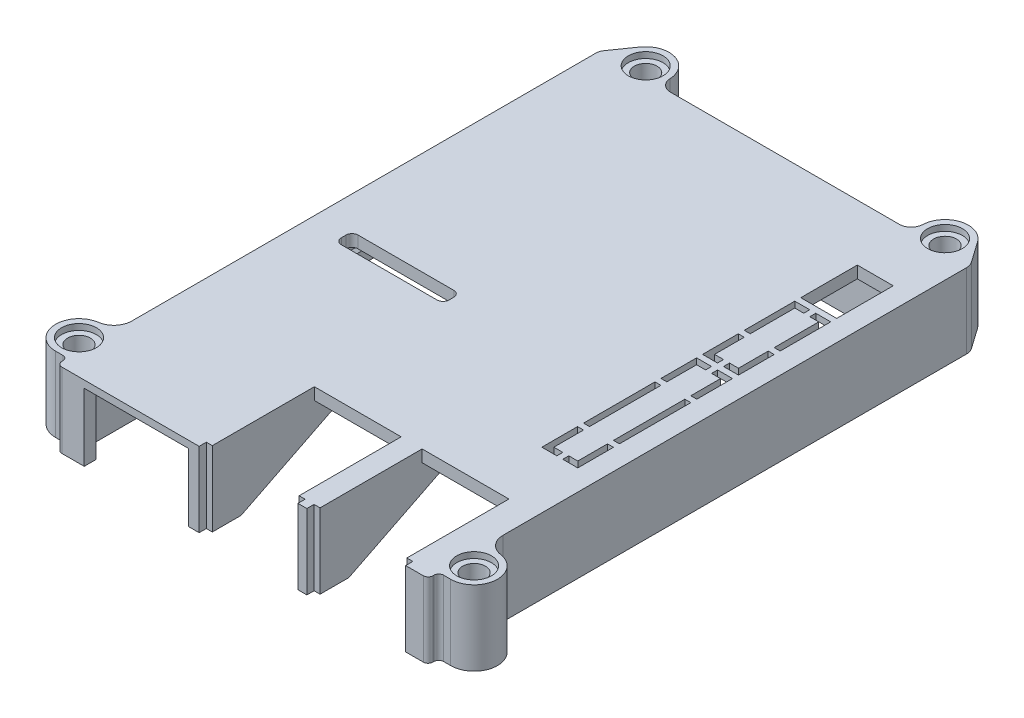
from build123d import *

# Parameters (mm, degrees)
CUT_EXTRUDE1_START                                 = -10.5
CUT_EXTRUDE1_DEPTH                                 = 12.5
CUT_EXTRUDE1_START_2                               = -4.07
CUT_EXTRUDE1_2_DEPTH                               = 6.07
CUT_EXTRUDE1_3_DEPTH                               = 2.5
CUT_EXTRUDE1_START_3                               = -74.55
CUT_EXTRUDE1_4_DEPTH                               = 26.9
CUT_EXTRUDE1_START_4                               = -87.55
CUT_EXTRUDE1_5_DEPTH                               = 15.9
SKETCH2_W                                          = 19.95
SKETCH2_H                                          = 39.9
CUT_EXTRUDE2_DEPTH                                 = 4.07
SKETCH3_W                                          = 39.9
SKETCH3_H                                          = 10.5
CUT_EXTRUDE3_DEPTH                                 = 2.8
SKETCH4_W                                          = 22.75
SKETCH4_H                                          = 10.5
CUT_EXTRUDE4_DEPTH                                 = 5.45
SKETCH5_W                                          = 45.35
SKETCH5_H                                          = 10.5
CUT_EXTRUDE5_DEPTH                                 = 14.5
CUT_EXTRUDE6_DEPTH                                 = 14.5
CUT_EXTRUDE7_DEPTH                                 = 3.5
CUT_EXTRUDE8_DEPTH                                 = 2.8
CUT_EXTRUDE9_DEPTH                                 = 17.4
CUT_EXTRUDE10_DEPTH                                = 14.5
SKETCH11_W                                         = 2.55
SKETCH11_H                                         = 10.5
CUT_EXTRUDE11_DEPTH                                = 41.25
CUT_EXTRUDE12_DEPTH                                = 2.75
BOSS_EXTRUDE1_DEPTH                                = 1.78
CUT_EXTRUDE13_DEPTH                                = 1.5
CUT_EXTRUDE14_DEPTH                                = 1
CUT_EXTRUDE15_DEPTH                                = 2.75
SKETCH17_W                                         = 52.7
SKETCH17_H                                         = 1
CUT_EXTRUDE16_DEPTH                                = 1
CUT_EXTRUDE17_DEPTH                                = 1.5
SKETCH19_W                                         = 1
SKETCH19_H                                         = 1
CUT_EXTRUDE18_DEPTH                                = 4.9625
SKETCH20_W                                         = 1.5
SKETCH20_H                                         = 1
CUT_EXTRUDE19_DEPTH                                = 1
SKETCH21_W                                         = 1
SKETCH21_H                                         = 1
CUT_EXTRUDE20_DEPTH                                = 11.925
SKETCH22_W                                         = 2.5
SKETCH22_H                                         = 1
CUT_EXTRUDE21_DEPTH                                = 1
SKETCH23_W                                         = 1
SKETCH23_H                                         = 1
CUT_EXTRUDE22_DEPTH                                = 11.925
SKETCH24_W                                         = 1.5
SKETCH24_H                                         = 1
CUT_EXTRUDE23_DEPTH                                = 1
SKETCH25_W                                         = 1.5
SKETCH25_H                                         = 1
CUT_EXTRUDE24_DEPTH                                = 1
SKETCH26_W                                         = 1.5
SKETCH26_H                                         = 1
CUT_EXTRUDE25_DEPTH                                = 1
SKETCH27_W                                         = 4.9625
SKETCH27_H                                         = 1
CUT_EXTRUDE26_DEPTH                                = 1
SKETCH28_W                                         = 1.5
SKETCH28_H                                         = 1
CUT_EXTRUDE27_DEPTH                                = 1
CUT_EXTRUDE28_DEPTH                                = 1
CUT_EXTRUDE29_DEPTH                                = 14.5
CUT_EXTRUDE30_DEPTH                                = 14.5
SKETCH32_W                                         = 1
SKETCH32_H                                         = 1
CUT_EXTRUDE31_DEPTH                                = 11.925
SKETCH33_W                                         = 33.4
SKETCH33_H                                         = 2
BOSS_EXTRUDE2_DEPTH                                = 3
CUT_EXTRUDE32_REACH                                = 124.251
SKETCH35_W                                         = 17.4
SKETCH35_H                                         = 22.7
SKETCH36_W                                         = 1.5
SKETCH36_H                                         = 21
CUT_EXTRUDE33_DEPTH                                = 5.93
CUT_EXTRUDE34_REACH                                = 123.333
SKETCH37_W                                         = 16.5
SKETCH37_H                                         = 3.93
SKETCH38_W                                         = 1
SKETCH38_H                                         = 1.2
CUT_EXTRUDE35_DEPTH                                = 123.053605027
SKETCH39_W                                         = 1
SKETCH39_H                                         = 1.2
CUT_EXTRUDE36_DEPTH                                = 123.397232403
SKETCH40_W                                         = 1
SKETCH40_H                                         = 1.2
CUT_EXTRUDE37_DEPTH                                = 123.397232403
SKETCH41_W                                         = 1
SKETCH41_H                                         = 1.2
CUT_EXTRUDE38_DEPTH                                = 123.397232403
CUT_EXTRUDE39_DEPTH                                = 123.160069172
SKETCH43_W                                         = 18
SKETCH43_H                                         = 2.8
CUT_EXTRUDE40_DEPTH                                = 123.160069172
SKETCH44_W                                         = 18
SKETCH44_H                                         = 2.8
CUT_EXTRUDE41_DEPTH                                = 123.160069172
CUT_EXTRUDE42_DEPTH                                = 123.160069172
CUT_EXTRUDE43_DEPTH                                = 123.160069172
CUT_EXTRUDE44_DEPTH                                = 123.160069172
CUT_EXTRUDE45_DEPTH                                = 123.160069172
CUT_EXTRUDE46_DEPTH                                = 123.397232403
SKETCH50_W                                         = 16.5
SKETCH50_H                                         = 1
CUT_EXTRUDE47_DEPTH                                = 1.5
SKETCH51_W                                         = 1.5
SKETCH51_H                                         = 12
CUT_EXTRUDE48_DEPTH                                = 2
F_8_0_8_DIAMETER_HOLE1_D                           = 8
CBORE_FOR_M3_5_HEX_HEAD_MACHINE_SCREW1_D           = 3.8
CBORE_FOR_M3_5_HEX_HEAD_MACHINE_SCREW1_CBORE_D     = 5.8
CBORE_FOR_M3_5_HEX_HEAD_MACHINE_SCREW1_CBORE_DEPTH = 1
CBORE_FOR_M6_HEX_HEAD_BOLT1_D                      = 7
CBORE_FOR_M6_HEX_HEAD_BOLT1_DEPTH                  = 2
CBORE_FOR_M6_HEX_HEAD_BOLT1_CBORE_D                = 9.5
CBORE_FOR_M6_HEX_HEAD_BOLT1_CBORE_DEPTH            = 1
CHAMFER1_SIZE                                      = 0.5
FILLET1_R                                          = 0.8
FILLET2_R                                          = 1
FILLET3_R                                          = 2
FILLET4_R                                          = 3
SKETCH59_W                                         = 23.655840722
SKETCH59_H                                         = 10.256378495
SKETCH59_H_2                                       = 9.778608779
BOSS_EXTRUDE3_DEPTH                                = 2
SKETCH60_W                                         = 25.28962762
SKETCH60_H                                         = 9.476601037
BOSS_EXTRUDE4_DEPTH                                = 2
SKETCH62_W                                         = 6
SKETCH62_H                                         = 18.8875
CUT_EXTRUDE49_DEPTH                                = 2
SKETCH64_W                                         = 6
SKETCH64_H                                         = 9.44375
BOSS_EXTRUDE5_DEPTH                                = 1
CUT_EXTRUDE50_DEPTH                                = 1


with BuildPart() as part:
    # Cut-Extrude1: read off the stored shape, not the designer's step
    # Cut-Extrude1 outline → Cut-Extrude1 (new body)
    with BuildSketch(Plane(origin=(0, 0, 0), x_dir=(1, 0, 0), z_dir=(0, 1, 0)).offset(CUT_EXTRUDE1_START)):
        with BuildLine():
            Line((52.514673616, 95), (9.485326384, 95))
            ThreePointArc((9.485326384, 95), (8.002589698, 100.096585499), (2.81042862, 98.994244731))
            Line((2.81042862, 98.994244731), (0, 95))
            Line((0, 95), (0, 13.428133809))
            ThreePointArc((0, 13.428133809), (-5.75950275, 11.117371232), (-2, 6.18))
            Line((-2, 6.18), (64, 6.18))
            ThreePointArc((64, 6.18), (67.75950275, 11.117371232), (62, 13.428133809))
            Line((62, 13.428133809), (62, 95))
            Line((62, 95), (59.18957138, 98.994244731))
            ThreePointArc((59.18957138, 98.994244731), (53.997410302, 100.096585499), (52.514673616, 95))
        make_face()
        Polygon((2.5, 71.15), (2, 71.65), (2, 87.55), (21.95, 87.55), (21.95, 47.65), (2, 47.65), (2.5, 48.15), align=None, mode=Mode.SUBTRACT)
    extrude(amount=CUT_EXTRUDE1_DEPTH)

    # Cut-Extrude1 2 outline → Cut-Extrude1 2 (add)
    with BuildSketch(Plane(origin=(0, 0, 0), x_dir=(1, 0, 0), z_dir=(0, 1, 0)).offset(CUT_EXTRUDE1_START_2)):
        Polygon((2, 71.65), (2.5, 71.15), (2.5, 48.15), (2, 47.65), (21.95, 47.65), (21.95, 87.55), (2, 87.55), align=None)
    extrude(amount=CUT_EXTRUDE1_2_DEPTH)

    # Cut-Extrude1 3 outline → Cut-Extrude1 3 (add)
    with BuildSketch(Plane(origin=(0, 0, 0), x_dir=(1, 0, 0), z_dir=(0, 1, 0)).offset(CUT_EXTRUDE1_START)):
        Polygon((2, 87.55), (2, 74.55), (2.5, 75.05), (2.5, 87.05), align=None)
    extrude(amount=CUT_EXTRUDE1_3_DEPTH)

    # Cut-Extrude1 4 outline → Cut-Extrude1 4 (cut)
    with BuildSketch(Plane.XY.offset(CUT_EXTRUDE1_START_3)):
        Polygon((2, -4.07), (2.5, -4.57), (2.5, -4.07), align=None)
    extrude(amount=CUT_EXTRUDE1_4_DEPTH, mode=Mode.SUBTRACT)

    # Cut-Extrude1 5 outline → Cut-Extrude1 5 (cut)
    with BuildSketch(Plane.XY.offset(CUT_EXTRUDE1_START_4)):
        Polygon((2.5, -8.5), (2.5, -8), (2, -8), align=None)
    extrude(amount=CUT_EXTRUDE1_5_DEPTH, mode=Mode.SUBTRACT)

    # Sketch2 → Cut-Extrude2 (cut)
    with BuildSketch(Plane.XZ.offset(4.07)):
        with Locations((11.975, -67.6)):
            Rectangle(SKETCH2_W, SKETCH2_H)
    extrude(amount=-CUT_EXTRUDE2_DEPTH, mode=Mode.SUBTRACT)

    # Sketch3 → Cut-Extrude3 (cut)
    with BuildSketch(Plane.ZY.offset(-21.95)):
        with Locations((-67.6, -5.25)):
            Rectangle(SKETCH3_W, SKETCH3_H)
    extrude(amount=-CUT_EXTRUDE3_DEPTH, mode=Mode.SUBTRACT)

    # Sketch4 → Cut-Extrude4 (cut)
    with BuildSketch(Plane.XY.offset(-87.55)):
        with Locations((13.375, -5.25)):
            Rectangle(SKETCH4_W, SKETCH4_H)
    extrude(amount=-CUT_EXTRUDE4_DEPTH, mode=Mode.SUBTRACT)

    # Sketch5 → Cut-Extrude5 (cut)
    with BuildSketch(Plane.ZY.offset(-24.75)):
        with Locations((-70.325, -5.25)):
            Rectangle(SKETCH5_W, SKETCH5_H)
    extrude(amount=-CUT_EXTRUDE5_DEPTH, mode=Mode.SUBTRACT)

    # Sketch6 → Cut-Extrude6 (cut)
    with BuildSketch(Plane(origin=(39.25, 0, 0), x_dir=(0, 0, -1), z_dir=(1, 0, 0))):
        Polygon((31.4, 0), (10.4, -10.5), (47.65, -10.5), (47.65, 0), align=None)
    extrude(amount=-CUT_EXTRUDE6_DEPTH, mode=Mode.SUBTRACT)

    # Sketch7 → Cut-Extrude7 (cut)
    with BuildSketch(Plane.ZY.offset(-39.25)):
        Polygon((-10.4, -10.5), (-31.4, 0), (-93, 0), (-93, -10.5), align=None)
    extrude(amount=-CUT_EXTRUDE7_DEPTH, mode=Mode.SUBTRACT)

    # Sketch8 → Cut-Extrude8 (cut)
    with BuildSketch(Plane(origin=(24.75, 0, 0), x_dir=(0, 0, -1), z_dir=(1, 0, 0))):
        Polygon((31.4, 0), (10.4, -10.5), (47.65, -10.5), (47.65, 0), align=None)
    extrude(amount=-CUT_EXTRUDE8_DEPTH, mode=Mode.SUBTRACT)

    # Sketch9 → Cut-Extrude9 (cut)
    with BuildSketch(Plane(origin=(21.95, 0, 0), x_dir=(0, 0, -1), z_dir=(1, 0, 0))):
        Polygon((47.65, 0), (6.18, 0), (6.18, -10.5), (6.4, -10.5), (47.65, -10.5), align=None)
    extrude(amount=-CUT_EXTRUDE9_DEPTH, mode=Mode.SUBTRACT)

    # Sketch10 → Cut-Extrude10 (cut)
    with BuildSketch(Plane.ZY.offset(-42.75)):
        Polygon((-10.4, -10.5), (-31.4, 0), (-93, 0), (-93, -10.5), align=None)
    extrude(amount=-CUT_EXTRUDE10_DEPTH, mode=Mode.SUBTRACT)

    # Sketch11 → Cut-Extrude11 (cut)
    with BuildSketch(Plane(origin=(0, 0, -47.65), x_dir=(-1, 0, 0), z_dir=(0, 0, -1))):
        with Locations((-3.275, -5.25)):
            Rectangle(SKETCH11_W, SKETCH11_H)
    extrude(amount=-CUT_EXTRUDE11_DEPTH, mode=Mode.SUBTRACT)

    # Sketch12 → Cut-Extrude12 (cut)
    with BuildSketch(Plane.ZY.offset(-57.25)):
        Polygon((-10.4, -10.5), (-31.4, 0), (-93, 0), (-93, -10.5), align=None)
    extrude(amount=-CUT_EXTRUDE12_DEPTH, mode=Mode.SUBTRACT)

    # Sketch13 → Boss-Extrude1 (add)
    with BuildSketch(Plane.XY.offset(-6.18)):
        Polygon((62, 2), (62, -10.5), (21.95, -10.5), (21.95, 0), (4.55, 0), (4.55, -10.5), (0, -10.5), (0, 2), align=None)
    extrude(amount=BOSS_EXTRUDE1_DEPTH)

    # Sketch14 → Cut-Extrude13 (cut)
    with BuildSketch(Plane(origin=(56, 0, 0), x_dir=(0, -1, 0), z_dir=(-1, 0, 0))):
        Polygon((-1, -33.9), (-1, -85.6), (0, -85.6), (0, -32.9), (-2, -32.9), (-2, -33.9), align=None)
    extrude(amount=-CUT_EXTRUDE13_DEPTH, mode=Mode.SUBTRACT)

    # Sketch15 → Cut-Extrude14 (cut)
    with BuildSketch(Plane.ZY.offset(-57.5)):
        Polygon((-58.75, 2), (-58.75, 1), (-79.6375, 1), (-79.6375, 2), (-85.6, 2), (-85.6, 0), (-32.9, 0), (-32.9, 2), (-33.9, 2), (-33.9, 1), (-52.7875, 1), (-52.7875, 2), align=None)
    extrude(amount=-CUT_EXTRUDE14_DEPTH, mode=Mode.SUBTRACT)

    # Sketch16 → Cut-Extrude15 (cut)
    with BuildSketch(Plane(origin=(60, 0, 0), x_dir=(0, 0, -1), z_dir=(1, 0, 0))):
        Polygon((6.4, 0), (6.4, -10.5), (10.4, -10.5), (31.4, 0), align=None)
    extrude(amount=-CUT_EXTRUDE15_DEPTH, mode=Mode.SUBTRACT)

    # Sketch17 → Cut-Extrude16 (cut)
    with BuildSketch(Plane(origin=(56, 0, 0), x_dir=(0, 0, -1), z_dir=(1, 0, 0))):
        with Locations((59.25, 0.5)):
            Rectangle(SKETCH17_W, SKETCH17_H)
    extrude(amount=-CUT_EXTRUDE16_DEPTH, mode=Mode.SUBTRACT)

    # Sketch18 → Cut-Extrude17 (cut)
    with BuildSketch(Plane(origin=(55, 0, 0), x_dir=(0, 0, -1), z_dir=(1, 0, 0))):
        Polygon((84.6, 2), (84.6, 1), (32.9, 1), (32.9, 0), (85.6, 0), (85.6, 2), align=None)
    extrude(amount=-CUT_EXTRUDE17_DEPTH, mode=Mode.SUBTRACT)

    # Sketch19 → Cut-Extrude18 (cut)
    with BuildSketch(Plane(origin=(0, 0, -65.7125), x_dir=(-1, 0, 0), z_dir=(0, 0, -1))):
        with Locations((-58, 1.5)):
            Rectangle(SKETCH19_W, SKETCH19_H)
    extrude(amount=-CUT_EXTRUDE18_DEPTH, mode=Mode.SUBTRACT)

    # Sketch20 → Cut-Extrude19 (cut)
    with BuildSketch(Plane.XY.offset(-57.75)):
        with Locations((54.25, 1.5)):
            Rectangle(SKETCH20_W, SKETCH20_H)
    extrude(amount=-CUT_EXTRUDE19_DEPTH, mode=Mode.SUBTRACT)

    # Sketch21 → Cut-Extrude20 (cut)
    with BuildSketch(Plane(origin=(0, 0, -51.7875), x_dir=(-1, 0, 0), z_dir=(0, 0, -1))):
        with Locations((-58, 1.5)):
            Rectangle(SKETCH21_W, SKETCH21_H)
    extrude(amount=-CUT_EXTRUDE20_DEPTH, mode=Mode.SUBTRACT)

    # Sketch22 → Cut-Extrude21 (cut)
    with BuildSketch(Plane(origin=(0, 0, -60.75), x_dir=(-1, 0, 0), z_dir=(0, 0, -1))):
        with Locations((-57.25, 1.5)):
            Rectangle(SKETCH22_W, SKETCH22_H)
    extrude(amount=-CUT_EXTRUDE21_DEPTH, mode=Mode.SUBTRACT)

    # Sketch23 → Cut-Extrude22 (cut)
    with BuildSketch(Plane(origin=(0, 0, -78.6375), x_dir=(-1, 0, 0), z_dir=(0, 0, -1))):
        with Locations((-58, 1.5)):
            Rectangle(SKETCH23_W, SKETCH23_H)
    extrude(amount=-CUT_EXTRUDE22_DEPTH, mode=Mode.SUBTRACT)

    # Sketch24 → Cut-Extrude23 (cut)
    with BuildSketch(Plane(origin=(0, 0, -58.75), x_dir=(-1, 0, 0), z_dir=(0, 0, -1))):
        with Locations((-56.75, 1.5)):
            Rectangle(SKETCH24_W, SKETCH24_H)
    extrude(amount=-CUT_EXTRUDE23_DEPTH, mode=Mode.SUBTRACT)

    # Sketch25 → Cut-Extrude24 (cut)
    with BuildSketch(Plane.XY.offset(-59.75)):
        with Locations((54.25, 1.5)):
            Rectangle(SKETCH25_W, SKETCH25_H)
    extrude(amount=-CUT_EXTRUDE24_DEPTH, mode=Mode.SUBTRACT)

    # Sketch26 → Cut-Extrude25 (cut)
    with BuildSketch(Plane(origin=(0, 0, -85.6), x_dir=(-1, 0, 0), z_dir=(0, 0, -1))):
        with Locations((-56.75, 1.5)):
            Rectangle(SKETCH26_W, SKETCH26_H)
    extrude(amount=-CUT_EXTRUDE25_DEPTH, mode=Mode.SUBTRACT)

    # Sketch27 → Cut-Extrude26 (cut)
    with BuildSketch(Plane(origin=(58.5, 0, 0), x_dir=(0, 0, -1), z_dir=(1, 0, 0))):
        with Locations((36.38125, 1.5)):
            Rectangle(SKETCH27_W, SKETCH27_H)
    extrude(amount=-CUT_EXTRUDE26_DEPTH, mode=Mode.SUBTRACT)

    # Sketch28 → Cut-Extrude27 (cut)
    with BuildSketch(Plane.XY.offset(-32.9)):
        with Locations((54.25, 1.5)):
            Rectangle(SKETCH28_W, SKETCH28_H)
    extrude(amount=-CUT_EXTRUDE27_DEPTH, mode=Mode.SUBTRACT)

    # Sketch29 → Cut-Extrude28 (cut)
    with BuildSketch(Plane(origin=(53.5, 0, 0), x_dir=(0, 0, -1), z_dir=(1, 0, 0))):
        Polygon((79.6375, 1), (65.7125, 1), (65.7125, 2), (59.75, 2), (59.75, 1), (58.75, 1), (58.75, 2), (52.7875, 2), (52.7875, 1), (51.7875, 1), (51.7875, 2), (39.8625, 2), (39.8625, 1), (38.8625, 1), (38.8625, 2), (32.9, 2), (32.9, 0), (85.6, 0), (85.6, 2), (79.6375, 2), align=None)
    extrude(amount=-CUT_EXTRUDE28_DEPTH, mode=Mode.SUBTRACT)

    # Sketch30 → Cut-Extrude29 (cut)
    with BuildSketch(Plane(origin=(57.25, 0, 0), x_dir=(0, 0, -1), z_dir=(1, 0, 0))):
        Polygon((22.65, 0), (22.65, 2), (4.4, 2), (4.4, -10.5), (10.4, -10.5), (31.4, 0), align=None)
    extrude(amount=-CUT_EXTRUDE29_DEPTH, mode=Mode.SUBTRACT)

    # Sketch31 → Cut-Extrude30 (cut)
    with BuildSketch(Plane(origin=(39.25, 0, 0), x_dir=(0, 0, -1), z_dir=(1, 0, 0))):
        Polygon((22.65, 0), (22.65, 2), (4.4, 2), (4.4, -10.5), (10.4, -10.5), (31.4, 0), align=None)
    extrude(amount=-CUT_EXTRUDE30_DEPTH, mode=Mode.SUBTRACT)

    # Sketch32 → Cut-Extrude31 (cut)
    with BuildSketch(Plane(origin=(0, 0, -78.6375), x_dir=(-1, 0, 0), z_dir=(0, 0, -1))):
        with Locations((-53, 1.5)):
            Rectangle(SKETCH32_W, SKETCH32_H)
    extrude(amount=-CUT_EXTRUDE31_DEPTH, mode=Mode.SUBTRACT)

    # Sketch33 → Boss-Extrude2 (add)
    with BuildSketch(Plane.XZ.offset(10.5)):
        with Locations((30.9, -94)):
            Rectangle(SKETCH33_W, SKETCH33_H)
    extrude(amount=BOSS_EXTRUDE2_DEPTH)

    # Sketch35 → Cut-Extrude32 (cut, up to next)
    with BuildSketch(Plane(origin=(0, 0.8, 0), x_dir=(1, 0, 0), z_dir=(0, 1, 0)), mode=Mode.PRIVATE) as cut_extrude32_sk1:
        with Locations((13.25, 15.75)):
            Rectangle(SKETCH35_W, SKETCH35_H)
    cut_extrude32_tool1 = extrude(cut_extrude32_sk1.sketch, amount=-CUT_EXTRUDE32_REACH, mode=Mode.PRIVATE) & part.part
    add(cut_extrude32_tool1.solids().sort_by_distance((13.25, 0.8, -15.75))[0], mode=Mode.SUBTRACT)

    # Sketch36 → Cut-Extrude33 (cut)
    with BuildSketch(Plane.XZ.offset(10.5)):
        with Locations((0.75, -59.65)):
            Rectangle(SKETCH36_W, SKETCH36_H)
    extrude(amount=-CUT_EXTRUDE33_DEPTH, mode=Mode.SUBTRACT)

    # Sketch37 → Cut-Extrude34 (cut, up to next)
    with BuildSketch(Plane.ZY.offset(-1.5), mode=Mode.PRIVATE) as cut_extrude34_sk1:
        with Locations((-59.65, -8.535)):
            Rectangle(SKETCH37_W, SKETCH37_H)
    cut_extrude34_tool1 = extrude(cut_extrude34_sk1.sketch, amount=-CUT_EXTRUDE34_REACH, mode=Mode.PRIVATE) & part.part
    add(cut_extrude34_tool1.solids().sort_by_distance((1.5, -8.535, -59.65))[0], mode=Mode.SUBTRACT)

    # Sketch38 → Cut-Extrude35 (cut, through all)
    with BuildSketch(Plane.XZ.offset(10.5)):
        with Locations((57.75, -5)):
            Rectangle(SKETCH38_W, SKETCH38_H)
    extrude(amount=-CUT_EXTRUDE35_DEPTH, mode=Mode.SUBTRACT)

    # Sketch39 → Cut-Extrude36 (cut, through all)
    with BuildSketch(Plane(origin=(0, 2, 0), x_dir=(-1, 0, 0), z_dir=(0, 1, 0))):
        with Locations((-42.25, -5)):
            Rectangle(SKETCH39_W, SKETCH39_H)
    extrude(amount=-CUT_EXTRUDE36_DEPTH, mode=Mode.SUBTRACT)

    # Sketch40 → Cut-Extrude37 (cut, through all)
    with BuildSketch(Plane(origin=(0, 2, 0), x_dir=(-1, 0, 0), z_dir=(0, 1, 0))):
        with Locations((-39.75, -5)):
            Rectangle(SKETCH40_W, SKETCH40_H)
    extrude(amount=-CUT_EXTRUDE37_DEPTH, mode=Mode.SUBTRACT)

    # Sketch41 → Cut-Extrude38 (cut, through all)
    with BuildSketch(Plane(origin=(0, 2, 0), x_dir=(-1, 0, 0), z_dir=(0, 1, 0))):
        with Locations((-24.25, -5)):
            Rectangle(SKETCH41_W, SKETCH41_H)
    extrude(amount=-CUT_EXTRUDE38_DEPTH, mode=Mode.SUBTRACT)

    # Sketch42 → Cut-Extrude39 (cut, through all)
    with BuildSketch(Plane.XZ):
        with BuildLine():
            ThreePointArc((24.74048455, -50.6630026), (15.701310427, -59.919298063), (10.28, -71.666428257))
            ThreePointArc((10.28, -71.666428257), (11.655307684, -72.974871868), (13.094066792, -74.213204671))
            ThreePointArc((13.094066792, -74.213204671), (18.225653636, -62.139926673), (27.465334007, -52.827272282))
            ThreePointArc((27.465334007, -52.827272282), (26.139869919, -51.698603415), (24.74048455, -50.6630026))
        make_face()
    extrude(amount=-CUT_EXTRUDE39_DEPTH, mode=Mode.SUBTRACT)

    # Sketch43 → Cut-Extrude40 (cut, through all)
    with BuildSketch(Plane.XZ):
        with Locations((14.45, -46.84)):
            Rectangle(SKETCH43_W, SKETCH43_H)
    extrude(amount=-CUT_EXTRUDE40_DEPTH, mode=Mode.SUBTRACT)

    # Sketch44 → Cut-Extrude41 (cut, through all)
    with BuildSketch(Plane.XZ):
        with Locations((31.1, -87.9)):
            Rectangle(SKETCH44_W, SKETCH44_H)
    extrude(amount=-CUT_EXTRUDE41_DEPTH, mode=Mode.SUBTRACT)

    # Sketch45 → Cut-Extrude42 (cut, through all)
    with BuildSketch(Plane.XZ):
        with BuildLine():
            ThreePointArc((26.315518398, -60.760969647), (29.018654382, -59.041355742), (32.195915053, -58.630222238))
            ThreePointArc((32.195915053, -58.630222238), (30.654498235, -56.33248481), (28.873207128, -54.215277903))
            ThreePointArc((28.873207128, -54.215277903), (19.681280882, -63.450781984), (14.805634119, -75.534411918))
            ThreePointArc((14.805634119, -75.534411918), (16.365657352, -76.611193595), (17.977295002, -77.609069014))
            ThreePointArc((17.977295002, -77.609069014), (20.762280225, -68.500007003), (26.315518398, -60.760969647))
        make_face()
    extrude(amount=-CUT_EXTRUDE42_DEPTH, mode=Mode.SUBTRACT)

    # Sketch46 → Cut-Extrude43 (cut, through all)
    with BuildSketch(Plane.XZ):
        with BuildLine():
            ThreePointArc((38.655068551, -64.067342145), (38.792663777, -67.263815991), (37.563627297, -70.217770428))
            ThreePointArc((37.563627297, -70.217770428), (40.322048744, -70.031403237), (43.044081492, -69.547503113))
            ThreePointArc((43.044081492, -69.547503113), (39.639517141, -56.969706411), (31.610529662, -46.706793162))
            ThreePointArc((31.610529662, -46.706793162), (29.89969107, -47.51876797), (28.231302896, -48.414732634))
            ThreePointArc((28.231302896, -48.414732634), (34.729626152, -55.384339754), (38.655068551, -64.067342145))
        make_face()
    extrude(amount=-CUT_EXTRUDE43_DEPTH, mode=Mode.SUBTRACT)

    # Sketch47 → Cut-Extrude44 (cut, through all)
    with BuildSketch(Plane.XZ):
        with BuildLine():
            ThreePointArc((48.185690358, -67.744868603), (44.689089872, -55.288561306), (37.226428257, -44.72))
            ThreePointArc((37.226428257, -44.72), (35.403953983, -45.257369176), (33.610529662, -45.884909865))
            ThreePointArc((33.610529662, -45.884909865), (41.502565282, -56.364411325), (44.94999168, -69.02219266))
            ThreePointArc((44.94999168, -69.02219266), (46.589647873, -68.438771436), (48.185690358, -67.744868603))
        make_face()
    extrude(amount=-CUT_EXTRUDE44_DEPTH, mode=Mode.SUBTRACT)

    # Sketch48 → Cut-Extrude45 (cut, through all)
    with BuildSketch(Plane.XZ):
        with BuildLine():
            ThreePointArc((21.669753361, -79.508070625), (34.205532161, -82.708079426), (47.089505541, -81.529505541))
            ThreePointArc((47.089505541, -81.529505541), (47.534685607, -79.685679593), (47.887567077, -77.821985927))
            ThreePointArc((47.887567077, -77.821985927), (34.865883657, -79.415936987), (22.18044376, -76.071608399))
            ThreePointArc((22.18044376, -76.071608399), (21.866506179, -77.781132137), (21.669753361, -79.508070625))
        make_face()
    extrude(amount=-CUT_EXTRUDE45_DEPTH, mode=Mode.SUBTRACT)

    # Sketch49 → Cut-Extrude46 (cut, through all)
    with BuildSketch(Plane(origin=(0, 2, 0), x_dir=(-1, 0, 0), z_dir=(0, 1, 0))):
        with BuildLine():
            ThreePointArc((-22.678158911, -74.158199299), (-23.620278341, -71.557275367), (-24.838592743, -69.07370851))
            ThreePointArc((-24.838592743, -69.07370851), (-26.782832425, -71.618285258), (-29.622324712, -73.098900776))
            ThreePointArc((-29.622324712, -73.098900776), (-39.103518173, -74.039974991), (-48.387303421, -71.897550765))
            ThreePointArc((-48.387303421, -71.897550765), (-48.328741597, -73.790870424), (-48.176170419, -75.678941095))
            ThreePointArc((-48.176170419, -75.678941095), (-35.273212125, -77.499865487), (-22.678158911, -74.158199299))
        make_face()
    extrude(amount=-CUT_EXTRUDE46_DEPTH, mode=Mode.SUBTRACT)

    # Sketch50 → Cut-Extrude47 (cut)
    with BuildSketch(Plane.XZ.offset(13.5)):
        with Locations((30.9, -94.5)):
            Rectangle(SKETCH50_W, SKETCH50_H)
    extrude(amount=-CUT_EXTRUDE47_DEPTH, mode=Mode.SUBTRACT)

    # Sketch51 → Cut-Extrude48 (cut)
    with BuildSketch(Plane.XZ.offset(10.5)):
        with Locations((0.75, -81.05)):
            Rectangle(SKETCH51_W, SKETCH51_H)
    extrude(amount=-CUT_EXTRUDE48_DEPTH, mode=Mode.SUBTRACT)

    # Ø8.0 (8) Diameter Hole1 (through all)
    with Locations(Plane(origin=(0, 0, 0), x_dir=(-1, 0, 0), z_dir=(0, -1, 0))):
        with Locations((-31.53111517, 65.975197807)):
            Hole(F_8_0_8_DIAMETER_HOLE1_D / 2)

    # CBORE for M3.5 Hex Head Machine Screw1 (through all)
    with Locations(Plane(origin=(0, 2, 0), x_dir=(1, 0, 0), z_dir=(0, 1, 0))):
        with Locations((6, 96.75), (56, 96.75), (64, 10.08), (-2, 10.08)):
            CounterBoreHole(CBORE_FOR_M3_5_HEX_HEAD_MACHINE_SCREW1_D / 2, CBORE_FOR_M3_5_HEX_HEAD_MACHINE_SCREW1_CBORE_D / 2, CBORE_FOR_M3_5_HEX_HEAD_MACHINE_SCREW1_CBORE_DEPTH)

    # CBORE for M6 Hex Head Bolt1
    with Locations(Plane.ZY):
        with Locations((-38.15, -10.5)):
            CounterBoreHole(CBORE_FOR_M6_HEX_HEAD_BOLT1_D / 2, CBORE_FOR_M6_HEX_HEAD_BOLT1_CBORE_D / 2, CBORE_FOR_M6_HEX_HEAD_BOLT1_CBORE_DEPTH, depth=CBORE_FOR_M6_HEX_HEAD_BOLT1_DEPTH)

    # Chamfer1
    chamfer1_edges = [part.edges().sort_by_distance(p)[0] for p in [
        (1.5, -4.57, -59.65),
        (1.5, -7.535, -49.15),
        (1.5, -7.535, -70.15),
        (1.5, -8.5, -81.05),
        (1.5, -9.5, -75.05),
        (1.5, -9.5, -87.05),
    ]]
    chamfer(chamfer1_edges, length=CHAMFER1_SIZE)

    # Fillet1
    fillet1_edges = [part.edges().sort_by_distance(p)[0] for p in [
        (0, -4.25, -4.4),
        (62, -4.25, -6.18),
        (0, -4.25, -6.18),
        (62, -4.25, -4.4),
    ]]
    fillet(fillet1_edges, radius=FILLET1_R)

    # Fillet2
    fillet2_edges = [part.edges().sort_by_distance(p)[0] for p in [
        (60, -5.25, -6.4),
        (5.45, 1, -45.44),
        (23.45, 1, -45.44),
        (40.1, 1, -86.5),
        (60, -5.25, -93),
        (23.45, 1, -48.24),
        (5.45, 1, -48.24),
        (2, -5.25, -93),
        (2, -5.25, -6.4),
        (22.1, 1, -89.3),
        (40.1, 1, -89.3),
        (22.1, 1, -86.5),
    ]]
    fillet(fillet2_edges, radius=FILLET2_R)

    # Fillet3
    fillet3_edges = [part.edges().sort_by_distance(p)[0] for p in [
        (52.514673616, -4.25, -95),
        (62, -4.25, -95),
        (0, -4.25, -95),
        (9.485326384, -4.25, -95),
    ]]
    fillet(fillet3_edges, radius=FILLET3_R)

    # Fillet4
    fillet4_edges = [part.edges().sort_by_distance(p)[0] for p in [
        (62, -4.25, -13.428133809),
        (0, -4.25, -13.428133809),
    ]]
    fillet(fillet4_edges, radius=FILLET4_R)

    # Sketch59 → Boss-Extrude3 (add)
    with BuildSketch(Plane(origin=(0, 2, 0), x_dir=(1, 0, 0), z_dir=(0, 1, 0))):
        with Locations((37.13551325, 44.843201974)):
            Rectangle(SKETCH59_W, SKETCH59_H)
        with Locations((37.13551325, 54.860695611)):
            Rectangle(SKETCH59_W, SKETCH59_H_2)
        Polygon((50.783113667, 84.131748628), (7.772494171, 84.131748628), (7.772494171, 49.971391221), (25.307592889, 49.971391221), (25.307592889, 59.75), (48.963433611, 59.75), (48.963433611, 49.971391221), (50.783113667, 49.971391221), align=None)
    extrude(amount=-BOSS_EXTRUDE3_DEPTH)

    # Sketch60 → Boss-Extrude4 (add)
    with BuildSketch(Plane(origin=(0, 2, 0), x_dir=(1, 0, 0), z_dir=(0, 1, 0))):
        with Locations((33.562330605, 86.341296113)):
            Rectangle(SKETCH60_W, SKETCH60_H)
    extrude(amount=-BOSS_EXTRUDE4_DEPTH)

    # Sketch62 → Cut-Extrude49 (cut)
    with BuildSketch(Plane(origin=(0, 2, 0), x_dir=(1, 0, 0), z_dir=(0, 1, 0))):
        with Locations((55.5, 76.15625)):
            Rectangle(SKETCH62_W, SKETCH62_H)
    extrude(amount=-CUT_EXTRUDE49_DEPTH, mode=Mode.SUBTRACT)

    # Sketch64 → Boss-Extrude5 (add)
    with BuildSketch(Plane(origin=(0, 2, 0), x_dir=(1, 0, 0), z_dir=(0, 1, 0))):
        with Locations((55.5, 71.434375)):
            Rectangle(SKETCH64_W, SKETCH64_H)
    extrude(amount=-BOSS_EXTRUDE5_DEPTH)

    # Sketch66 → Cut-Extrude50 (cut)
    with BuildSketch(Plane(origin=(0, 2, 0), x_dir=(1, 0, 0), z_dir=(0, 1, 0))):
        Polygon((55, 75.15625), (55, 74.15625), (53.5, 74.15625), (53.5, 66.7125), (52.5, 66.7125), (52.5, 75.15625), (53.5, 75.15625), align=None)
        Polygon((57.5, 75.15625), (56, 75.15625), (56, 74.15625), (57.5, 74.15625), (57.5, 66.7125), (58.5, 66.7125), (58.5, 75.15625), align=None)
    extrude(amount=-CUT_EXTRUDE50_DEPTH, mode=Mode.SUBTRACT)


solid = part.part
